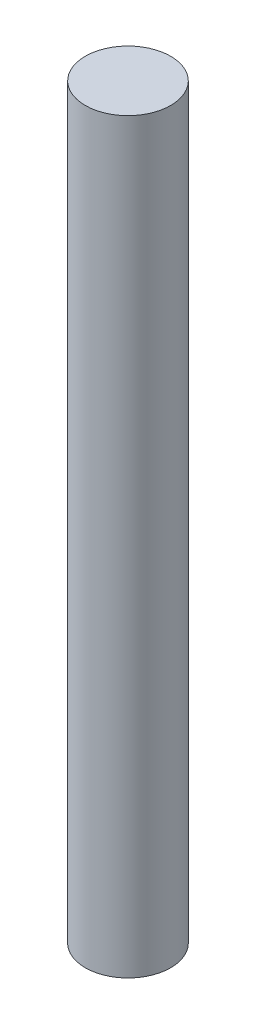
from build123d import *

# Parameters (mm, degrees)
BOSS_EXTRUDE1_DEPTH      = 12.7
BOSS_EXTRUDE1_DEPTH_BACK = 4.8
SKETCH1_R                = 1


with BuildPart() as part:
    # Sketch1 → Boss-Extrude1 (new, two sides: drawn at the far end of the back side and taken through both)
    with BuildSketch(Plane(origin=(0, 0, 0), x_dir=(1, 0, 0), z_dir=(0, 1, 0)).offset(-BOSS_EXTRUDE1_DEPTH_BACK)):
        Circle(SKETCH1_R)
    extrude(amount=BOSS_EXTRUDE1_DEPTH + BOSS_EXTRUDE1_DEPTH_BACK)


solid = part.part
